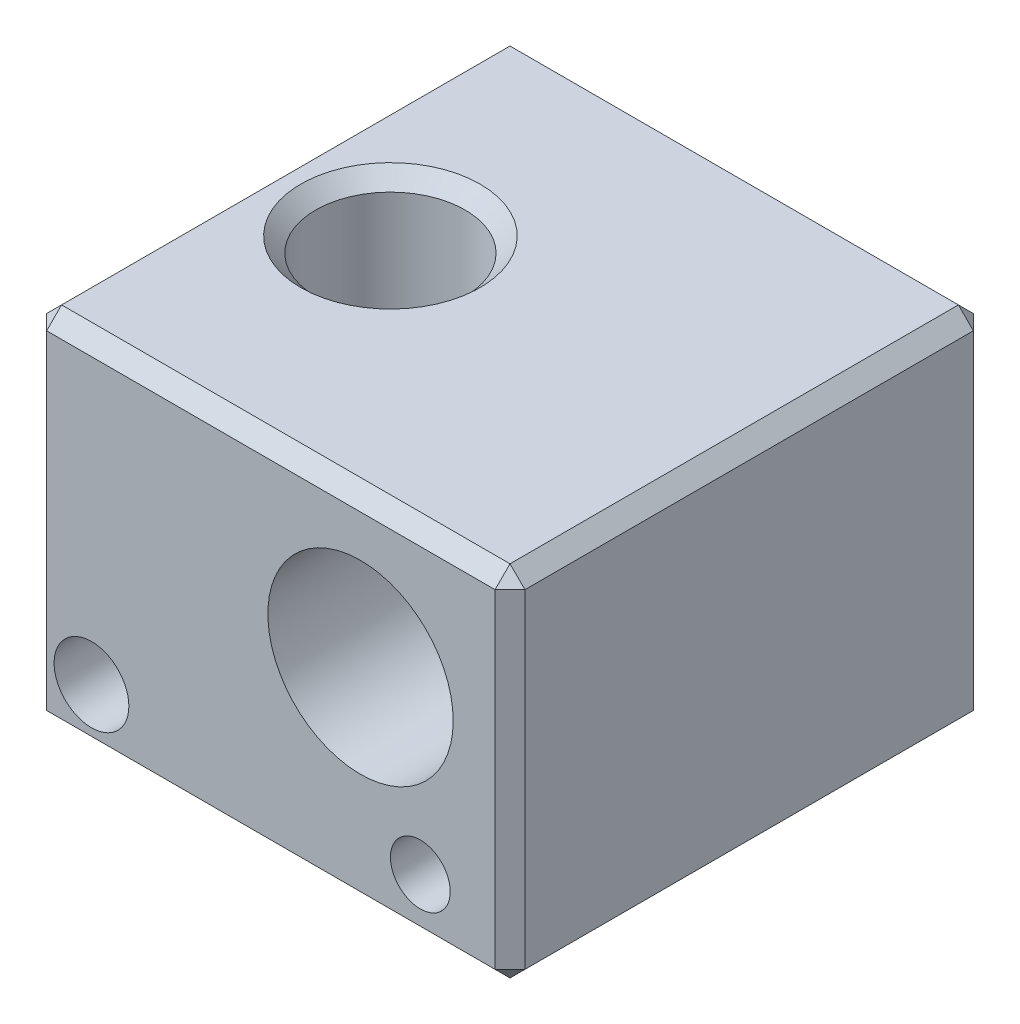
from build123d import *

# Parameters (mm, degrees)
SKETCH1_W                       = 16
SKETCH1_H                       = 16
BOSS_EXTRUDE1_DEPTH             = 12
SKETCH2_R                       = 3.1
SKETCH2_R_2                     = 1
CUT_EXTRUDE1_DEPTH              = 22.540659229
F_2_5_2_5_DIAMETER_HOLE1_D      = 2.5
F_2_5_2_5_DIAMETER_HOLE1_DEPTH  = 4.5
TAP_DRILL_FOR_M6X1_0_TAP1_D     = 5
TAP_DRILL_FOR_M3X0_5_TAP1_D     = 2.5
TAP_DRILL_FOR_M3X0_5_TAP1_DEPTH = 6.999
TAP_DRILL_FOR_M3X0_5_TAP1_TIP   = 0.751075774
CHAMFER1_SIZE                   = 0.5


with BuildPart() as part:
    # Sketch1 → Boss-Extrude1 (new body)
    with BuildSketch(Plane(origin=(0, 0, 0), x_dir=(1, 0, 0), z_dir=(0, 1, 0))):
        Rectangle(SKETCH1_W, SKETCH1_H)
    extrude(amount=BOSS_EXTRUDE1_DEPTH)

    # Sketch2 → Cut-Extrude1 (cut, through all)
    with BuildSketch(Plane.XY.offset(8)):
        with Locations((3, 7)):
            Circle(SKETCH2_R)
        with Locations((5, 2)):
            Circle(SKETCH2_R_2)
    extrude(amount=-CUT_EXTRUDE1_DEPTH, mode=Mode.SUBTRACT)

    # Ø2.5 (2.5) Diameter Hole1
    with Locations(Plane.XY.offset(8)):
        with Locations((-6, 2)):
            Hole(F_2_5_2_5_DIAMETER_HOLE1_D / 2, depth=F_2_5_2_5_DIAMETER_HOLE1_DEPTH)

    # Tap Drill for M6x1.0 Tap1 (through all)
    with Locations(Plane(origin=(0, 12, 0), x_dir=(1, 0, 0), z_dir=(0, 1, 0))):
        with Locations((-4, 0)):
            Hole(TAP_DRILL_FOR_M6X1_0_TAP1_D / 2)

    # Tap Drill for M3x0.5 Tap1
    with Locations(Plane(origin=(0, 0, 0), x_dir=(-1, 0, 0), z_dir=(0, -1, 0))):
        with Locations((-2, 0)):
            Hole(TAP_DRILL_FOR_M3X0_5_TAP1_D / 2, depth=TAP_DRILL_FOR_M3X0_5_TAP1_DEPTH)
            with Locations((0, 0, -(TAP_DRILL_FOR_M3X0_5_TAP1_DEPTH + TAP_DRILL_FOR_M3X0_5_TAP1_TIP / 2))):  # 118° drill point
                Cone(0, TAP_DRILL_FOR_M3X0_5_TAP1_D / 2, TAP_DRILL_FOR_M3X0_5_TAP1_TIP, mode=Mode.SUBTRACT)

    # Chamfer1
    chamfer1_edges = [part.edges().sort_by_distance(p)[0] for p in [
        (-1.5, 0, 0),
        (0.75, 0, 0),
        (-8, 6, -8),
        (-8, 6, 8),
        (8, 6, 8),
        (8, 0, 0),
        (0, 0, 8),
        (-8, 0, 0),
        (0, 0, -8),
        (8, 6, -8),
        (-8, 12, 0),
        (0, 12, -8),
        (8, 12, 0),
        (0, 12, 8),
        (-1.5, 12, 0),
    ]]
    chamfer(chamfer1_edges, length=CHAMFER1_SIZE)


solid = part.part
